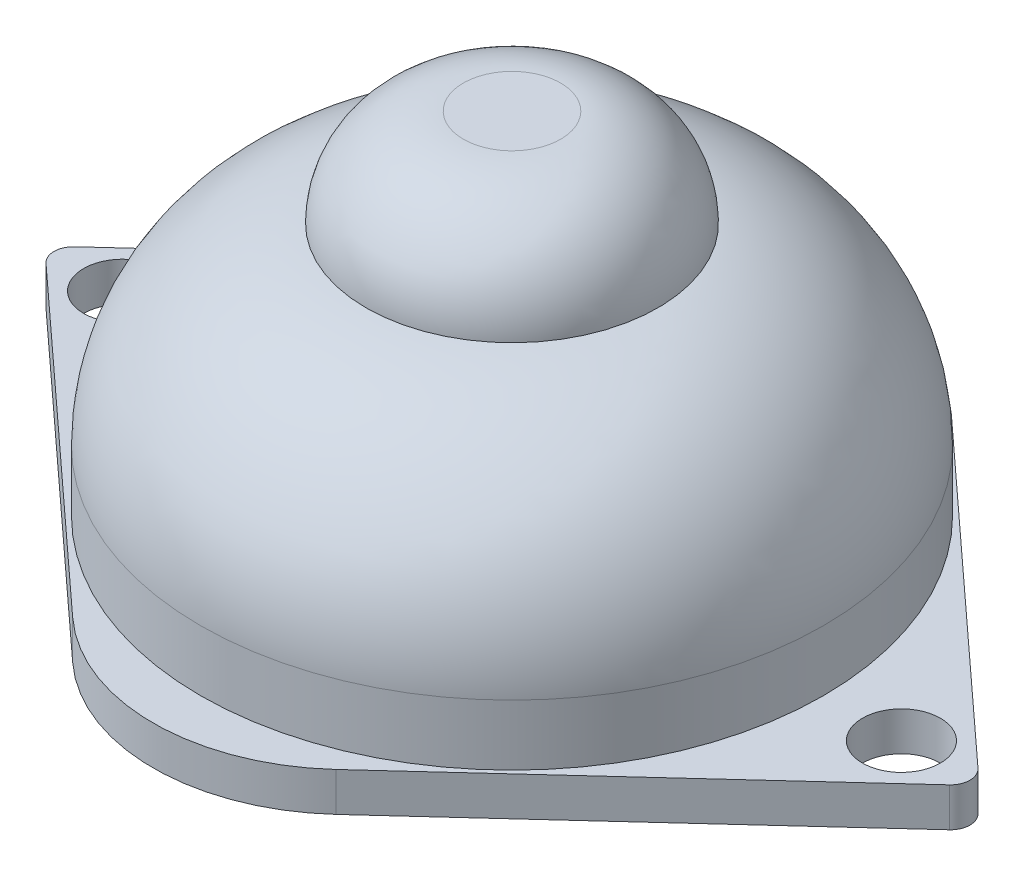
from build123d import *

# Parameters (mm, degrees)
SKETCH1_R           = 16
BOSS_EXTRUDE1_DEPTH = 13
SKETCH2_R           = 7.5
BOSS_EXTRUDE2_DEPTH = 5
FILLET3_R           = 10
FILLET4_R           = 5
SKETCH3_R           = 2
BOSS_EXTRUDE3_DEPTH = 2


# Some blends are built 0.0001 mm under size
with BuildPart() as part:
    # Sketch1 → Boss-Extrude1 (new body)
    with BuildSketch(Plane(origin=(0, 0, 0), x_dir=(1, 0, 0), z_dir=(0, 1, 0))):
        with Locations(Location((0, 0, 0), (0, 0, 90))):
            Circle(SKETCH1_R)
    extrude(amount=BOSS_EXTRUDE1_DEPTH)

    # Sketch2 → Boss-Extrude2 (add)
    with BuildSketch(Plane(origin=(0, 13, 0), x_dir=(1, 0, 0), z_dir=(0, 1, 0))):
        with Locations(Location((0, 0, 0), (0, 0, 270))):
            Circle(SKETCH2_R)
    extrude(amount=BOSS_EXTRUDE2_DEPTH)

    # Fillet3
    # the kernel refuses this fillet: 10 mm, written as the material it takes off along each edge
    with BuildSketch(Plane(origin=(0, 13, 0), x_dir=(0, 0, -1), z_dir=(1, 0, 0))) as fillet3_piece_1:
        with BuildLine():
            CenterArc((6, -9.886859967), FILLET3_R, 0, 81.373073441)
            Line((7.5, 0), (7.53, 0.197737199))
            ThreePointArc((7.53, 0.197737199), (11.75, 0.2), (16, 0.2))
            Line((16, 0.2), (16.2, 0))
            Line((16.2, 0), (16.2, -9.886859967))
            Line((16.2, -9.886859967), (16, -9.886859967))
        make_face()
    revolve(axis=Axis((0, 13, 0), (0, 1, 0)), mode=Mode.SUBTRACT)

    # Fillet4
    fillet4_edges = [part.edges().sort_by_distance(p)[0] for p in [
        (0, 18, -7.5),
    ]]
    fillet(fillet4_edges, radius=FILLET4_R - 0.0001)  # a hair under: the kernel refuses the full size

    # Sketch3 → Boss-Extrude3 (add)
    with BuildSketch(Plane.XZ):
        with BuildLine():
            Line((6.757246285, 15.805857572), (23.195831847, 0.73715414))
            ThreePointArc((23.195831847, 0.73715414), (23.520107219, 0), (23.195831847, -0.73715414))
            Line((23.195831847, -0.73715414), (6.757246285, -15.805857572))
            ThreePointArc((6.757246285, -15.805857572), (0, -18.43431617), (-6.757246285, -15.805857572))
            Line((-6.757246285, -15.805857572), (-23.195831847, -0.73715414))
            ThreePointArc((-23.195831847, -0.73715414), (-23.520107219, 0), (-23.195831847, 0.73715414))
            Line((-23.195831847, 0.73715414), (-6.757246285, 15.805857572))
            ThreePointArc((-6.757246285, 15.805857572), (0, 18.43431617), (6.757246285, 15.805857572))
        make_face()
        with Locations(Location((20, 0, 0), (0, 0, 270))):
            Circle(SKETCH3_R, mode=Mode.SUBTRACT)
        with Locations(Location((-20, 0, 0), (0, 0, 90))):
            Circle(SKETCH3_R, mode=Mode.SUBTRACT)
    extrude(amount=BOSS_EXTRUDE3_DEPTH)


solid = part.part
